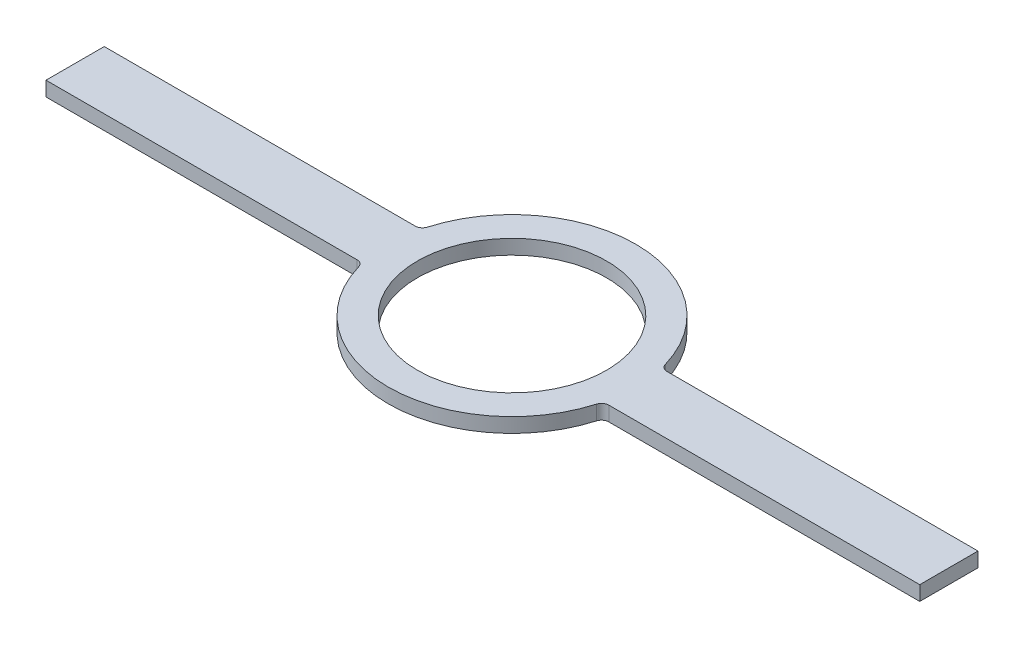
from build123d import *

# Parameters (mm, degrees)
SKETCH1_R           = 41.275
BOSS_EXTRUDE1_DEPTH = 6.35
FILLET1_R           = 3.175


with BuildPart() as part:
    # Sketch1 → Boss-Extrude1 (new body)
    with BuildSketch(Plane(origin=(0, 0, 0), x_dir=(1, 0, 0), z_dir=(0, 1, 0))):
        with BuildLine():
            Line((52.459609463, 12.7), (190.5, 12.7))
            Line((190.5, 12.7), (190.5, -12.7))
            Line((190.5, -12.7), (52.459609463, -12.7))
            ThreePointArc((52.459609463, -12.7), (0, -53.975), (-52.459609463, -12.7))
            Line((-52.459609463, -12.7), (-190.5, -12.7))
            Line((-190.5, -12.7), (-190.5, 12.7))
            Line((-190.5, 12.7), (-52.459609463, 12.7))
            ThreePointArc((-52.459609463, 12.7), (0, 53.975), (52.459609463, 12.7))
        make_face()
        Circle(SKETCH1_R, mode=Mode.SUBTRACT)
    extrude(amount=BOSS_EXTRUDE1_DEPTH)

    # Fillet1
    fillet1_edges = [part.edges().sort_by_distance(p)[0] for p in [
        (-52.459609463, 3.175, -12.7),
        (52.459609463, 3.175, -12.7),
        (52.459609463, 3.175, 12.7),
        (-52.459609463, 3.175, 12.7),
    ]]
    fillet(fillet1_edges, radius=FILLET1_R)


solid = part.part
